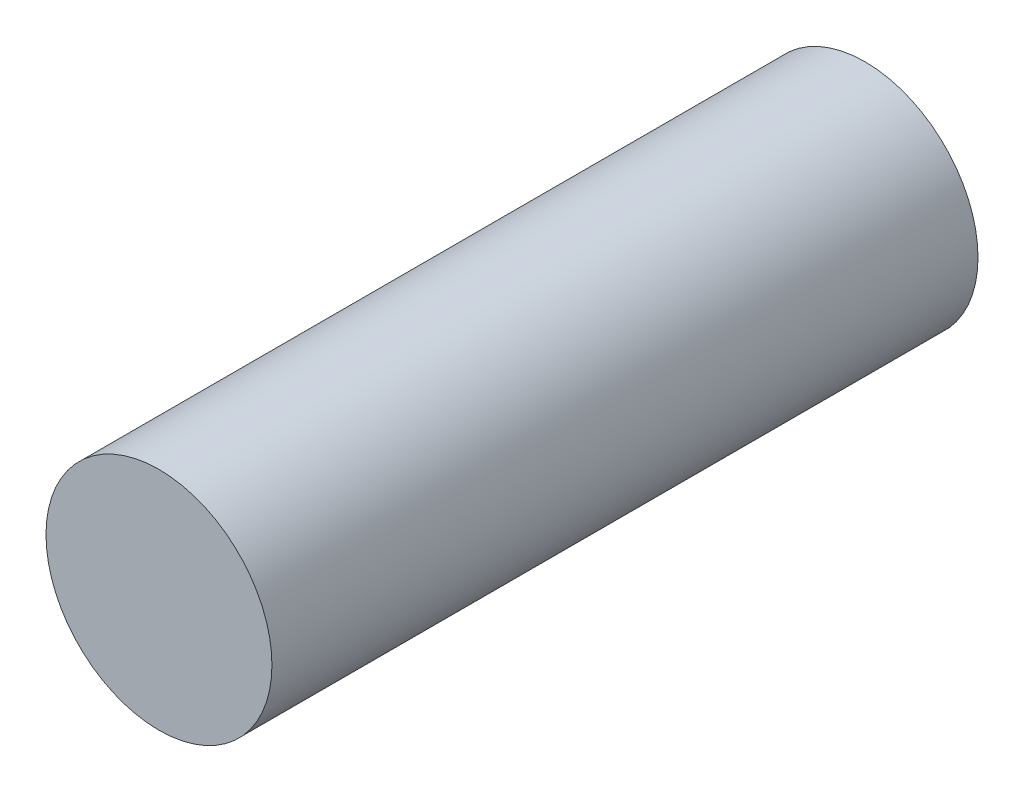
from build123d import *

# Parameters (mm, degrees)
CROQUIS4_R              = 2
SALIENTE_EXTRUIR1_DEPTH = 10
SALIENTE_EXTRUIR2_START = 2.5
CROQUIS5_R              = 2
SALIENTE_EXTRUIR2_DEPTH = 2.5


with BuildPart() as part:
    # Croquis4 → Saliente-Extruir1 (new body)
    with BuildSketch(Plane.XY):
        Circle(CROQUIS4_R)
    extrude(amount=SALIENTE_EXTRUIR1_DEPTH)

    # Croquis5 → Saliente-Extruir2 (add)
    with BuildSketch(Plane(origin=(0, 0, 0), x_dir=(-1, 0, 0), z_dir=(0, 0, -1)).offset(SALIENTE_EXTRUIR2_START)):
        Circle(CROQUIS5_R)
    extrude(amount=-SALIENTE_EXTRUIR2_DEPTH)


solid = part.part
